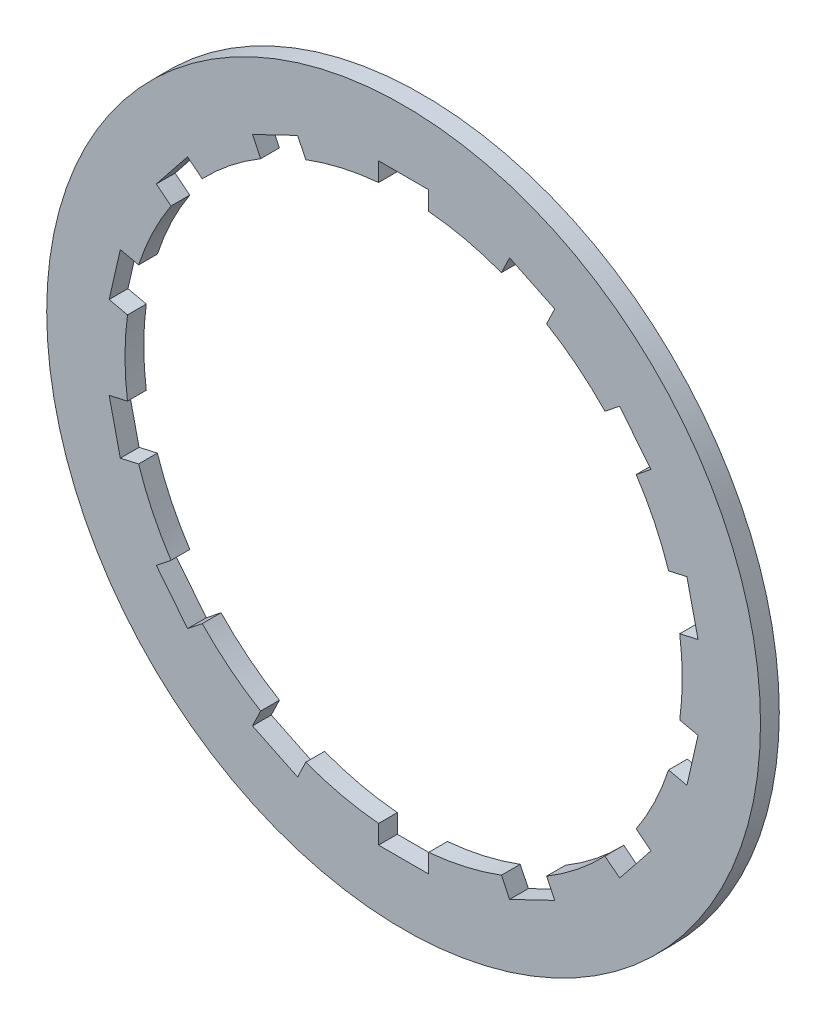
from build123d import *

# Parameters (mm, degrees)
SKETCH1_R           = 57
SKETCH1_R_2         = 44.5
BOSS_EXTRUDE1_DEPTH = 3
CUT_EXTRUDE1_REACH  = 82.666
SKETCH3_W           = 8
SKETCH3_H           = 3
CIRPATTERN1_COUNT   = 14


with BuildPart() as part:
    # Sketch1 → Boss-Extrude1 (new body)
    with BuildSketch(Plane.XY):
        Circle(SKETCH1_R)
        Circle(SKETCH1_R_2, mode=Mode.SUBTRACT)
    extrude(amount=BOSS_EXTRUDE1_DEPTH)

    # Sketch3 → Cut-Extrude1 (cut, up to next)
    with BuildSketch(Plane.XY.offset(3), mode=Mode.PRIVATE) as cut_extrude1_sk1:
        with Locations((0, 45.819860108)):
            Rectangle(SKETCH3_W, SKETCH3_H)
    cut_extrude1_tool1 = extrude(cut_extrude1_sk1.sketch, amount=-CUT_EXTRUDE1_REACH, mode=Mode.PRIVATE) & part.part
    cut_extrude1 = cut_extrude1_tool1.solids().sort_by_distance((0, 45.81986, 3))[0]
    add(cut_extrude1, mode=Mode.SUBTRACT)

    # CirPattern1: Cut-Extrude1 ×14 about axis
    cirpattern1_axis = Axis((0, 0, 3), (0, 0, -1))
    for i in range(1, CIRPATTERN1_COUNT):
        add(cut_extrude1.rotate(cirpattern1_axis, i * 360 / CIRPATTERN1_COUNT), mode=Mode.SUBTRACT)


solid = part.part
